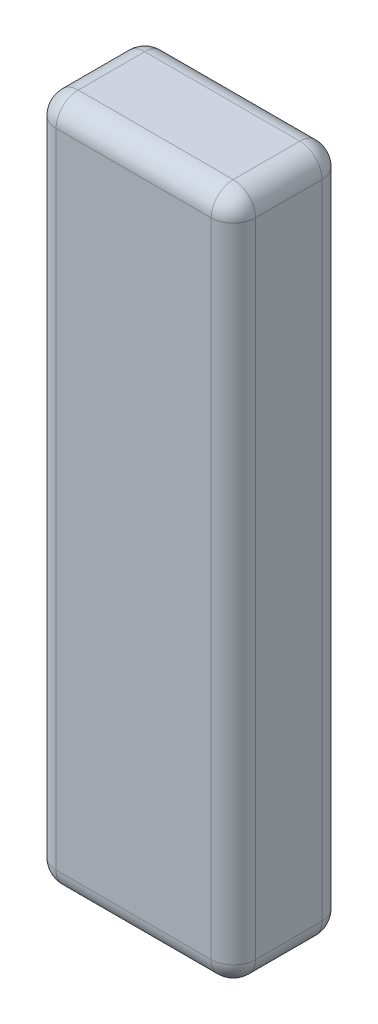
from build123d import *

# Parameters (mm, degrees)
SKETCH1_W           = 18
SKETCH1_H           = 10
BOSS_EXTRUDE1_DEPTH = 62
FILLET1_R           = 2


with BuildPart() as part:
    # Sketch1 → Boss-Extrude1 (new body)
    with BuildSketch(Plane(origin=(0, 0, 0), x_dir=(1, 0, 0), z_dir=(0, 1, 0))):
        Rectangle(SKETCH1_W, SKETCH1_H)
    extrude(amount=BOSS_EXTRUDE1_DEPTH)

    # Fillet1
    fillet1_edges = [part.edges().sort_by_distance(p)[0] for p in [
        (-9, 62, 0),
        (0, 62, -5),
        (9, 62, 0),
        (0, 62, 5),
        (0, 0, 5),
        (9, 0, 0),
        (-9, 0, 0),
        (0, 0, -5),
        (-9, 31, 5),
        (-9, 31, -5),
        (9, 31, -5),
        (9, 31, 5),
    ]]
    fillet(fillet1_edges, radius=FILLET1_R)


solid = part.part
